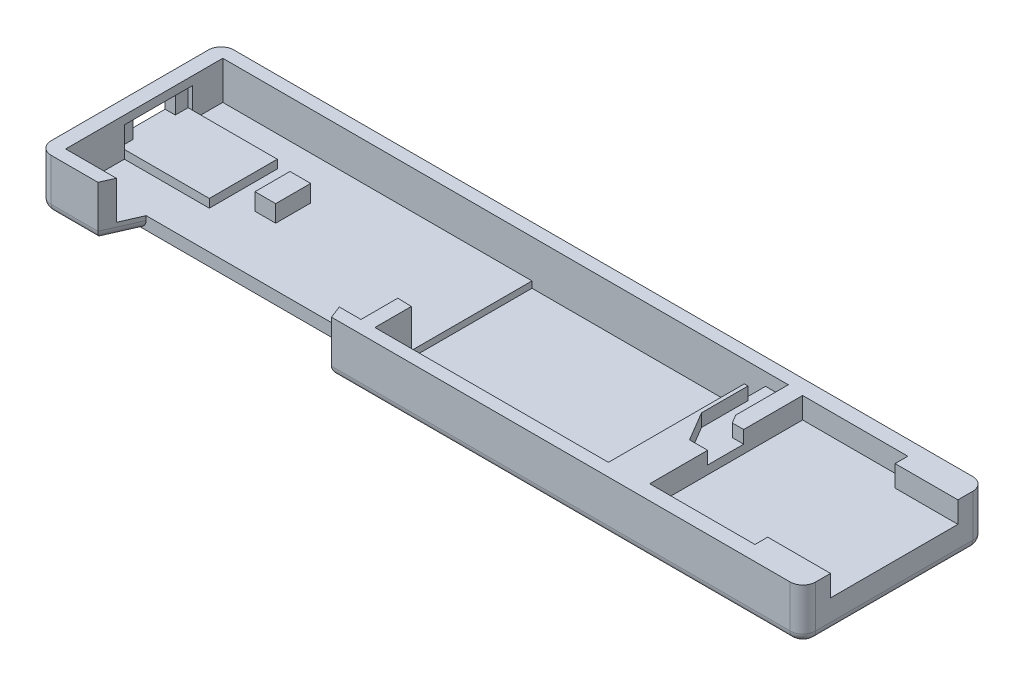
from build123d import *

# Parameters (mm, degrees)
SKETCH_3_W           = 180
SKETCH_3_H           = 43
EXTRUDE_1_DEPTH      = 12
CUT_EXTRUDE_1_DEPTH  = 52
CUT_EXTRUDE_2_DEPTH  = 5
CUT_EXTRUDE_3_DEPTH  = 5
SKETCH_8_W           = 55
SKETCH_8_H           = 37
CUT_EXTRUDE_4_DEPTH  = 10.5
CUT_EXTRUDE_5_DEPTH  = 3
SKETCH_10_W          = 62.128790526
SKETCH_10_H          = 8.683746703
CUT_EXTRUDE_6_DEPTH  = 8
CUT_EXTRUDE_8_DEPTH  = 9
FILLET_2_R           = 2
FILLET_3_R           = 3
SKETCH_12_W          = 20
SKETCH_12_H          = 16
EXTRUDE_2_DEPTH      = 2
SKETCH_13_W          = 16
SKETCH_13_H          = 5
CUT_EXTRUDE_9_DEPTH  = 1
SKETCH_14_W          = 10
SKETCH_14_H          = 4.5
CUT_EXTRUDE_10_DEPTH = 11
EXTRUDE_3_DEPTH      = 2
EXTRUDE_3_DEPTH_BACK = 3
SKETCH_15_W          = 4.878003414
SKETCH_15_H          = 8.248491994


with BuildPart() as part:
    # 草图3 → 凸台-拉伸1 (new body)
    with BuildSketch(Plane(origin=(0, 0, 0), x_dir=(1, 0, 0), z_dir=(0, 1, 0))):
        with Locations((50.068597249, 7.753123643)):
            Rectangle(SKETCH_3_W, SKETCH_3_H)
    extrude(amount=EXTRUDE_1_DEPTH)

    # 草图4 → 切除-拉伸1 (cut)
    with BuildSketch(Plane(origin=(0, 0, 0), x_dir=(1, 0, 0), z_dir=(0, 1, 0))):
        Polygon((-22.469613434, -5.858946979), (26.002261286, -5.858946979), (29.068597249, -13.746876357), (-25.931402751, -13.746876357), align=None)
    extrude(amount=CUT_EXTRUDE_1_DEPTH, mode=Mode.SUBTRACT)

    # 草图5 → 切除-拉伸2 (cut)
    with BuildSketch(Plane(origin=(0, 12, 0), x_dir=(1, 0, 0), z_dir=(0, 1, 0))):
        Polygon((140.068597249, 7.753123643), (140.068597249, 22.753123643), (125.276479966, 22.753123643), (125.276479966, -7.246876357), (140.068597249, -7.246876357), align=None)
    extrude(amount=-CUT_EXTRUDE_2_DEPTH, mode=Mode.SUBTRACT)

    # 草图7 → 切除-拉伸3 (cut)
    with BuildSketch(Plane(origin=(0, 12, 0), x_dir=(1, 0, 0), z_dir=(0, 1, 0))):
        Polygon((125.276479966, 7.753123643), (125.276479966, 25.753123643), (100.500825538, 25.753123643), (100.500825538, -10.246876357), (125.276479966, -10.246876357), align=None)
    extrude(amount=-CUT_EXTRUDE_3_DEPTH, mode=Mode.SUBTRACT)

    # 草图8 → 切除-拉伸4 (cut)
    with BuildSketch(Plane(origin=(0, 12, 0), x_dir=(1, 0, 0), z_dir=(0, 1, 0))):
        with Locations((63.776287419, 7.753123643)):
            Rectangle(SKETCH_8_W, SKETCH_8_H)
    extrude(amount=-CUT_EXTRUDE_4_DEPTH, mode=Mode.SUBTRACT)

    # 草图9 → 切除-拉伸5 (cut)
    with BuildSketch(Plane(origin=(0, 12, 0), x_dir=(1, 0, 0), z_dir=(0, 1, 0))):
        Polygon((91.276287419, 26.253123643), (96.635770173, 26.253123643), (96.635770173, 22.130591531), (96.635770173, 13.862098754), (97.813575381, 11.877191358), (100.500825538, 11.877191358), (100.500825538, 3.393971617), (96.236747254, 3.393971617), (92.132656028, 10.310430274), (92.132656028, 21.255120764), (91.276287419, 21.255120764), align=None)
    extrude(amount=-CUT_EXTRUDE_5_DEPTH, mode=Mode.SUBTRACT)

    # 草图10 → 切除-拉伸6 (cut)
    with BuildSketch(Plane(origin=(0, 12, 0), x_dir=(1, 0, 0), z_dir=(0, 1, 0))):
        with Locations((1.934159822, -6.405003006)):
            Rectangle(SKETCH_10_W, SKETCH_10_H)
    extrude(amount=-CUT_EXTRUDE_6_DEPTH, mode=Mode.SUBTRACT)

    # 草图11 → 切除-拉伸8 (cut)
    with BuildSketch(Plane(origin=(0, 12, 0), x_dir=(1, 0, 0), z_dir=(0, 1, 0))):
        Polygon((32.998555085, -10.746876357), (-36.5396752, -10.746876357), (-36.5396752, 26.253123643), (36.276287419, 26.253123643), (36.276287419, -2.167243749), (32.998555085, -2.063129654), align=None)
    extrude(amount=-CUT_EXTRUDE_8_DEPTH, mode=Mode.SUBTRACT)

    # 圆角2
    fillet_2_edges = [part.edges().sort_by_distance(p)[0] for p in [
        (84.568597249, 0, 13.746876357),
        (-24.200508092, 0, 9.802911668),
        (27.535429268, 0, 9.802911668),
        (50.068597249, 0, -29.253123643),
        (140.068597249, 0, -7.753123643),
        (-32.931402751, 0, 13.746876357),
        (-39.931402751, 0, -7.753123643),
    ]]
    fillet(fillet_2_edges, radius=FILLET_2_R)

    # 圆角3
    # the kernel refuses this fillet: 3 mm, written as the material it takes off along each edge
    with BuildSketch(Plane(origin=(-36.931402751, 0, 10.746876357), x_dir=(0, 0, 1), z_dir=(1, 0, 0))) as fillet_3_piece_1:
        with BuildLine():
            CenterArc((1, -2), 2, 0, 90)
            Line((3, -2), (3, 0))
            Line((3, 0), (1, 0))
        make_face()
    revolve(axis=Axis((-36.931402751, 0, 10.746876357), (0, -1, 0)), revolution_arc=90, mode=Mode.SUBTRACT)
    with BuildSketch(Plane(origin=(-36.931402751, 0, -26.253123643), x_dir=(-1, 0, 0), z_dir=(0, 0, 1))) as fillet_3_piece_2:
        with BuildLine():
            CenterArc((1, -2), 2, 0, 90)
            Line((3, -2), (3, 0))
            Line((3, 0), (1, 0))
        make_face()
    revolve(axis=Axis((-36.931402751, 0, -26.253123643), (0, -1, 0)), revolution_arc=90, mode=Mode.SUBTRACT)
    with BuildSketch(Plane(origin=(137.068597249, 0, 10.746876357), x_dir=(1, 0, 0), z_dir=(0, 0, -1))) as fillet_3_piece_3:
        with BuildLine():
            CenterArc((1, -2), 2, 0, 90)
            Line((3, -2), (3, 0))
            Line((3, 0), (1, 0))
        make_face()
    revolve(axis=Axis((137.068597249, 0, 10.746876357), (0, -1, 0)), revolution_arc=90, mode=Mode.SUBTRACT)
    with BuildSketch(Plane(origin=(137.068597249, 0, -26.253123643), x_dir=(0, 0, -1), z_dir=(-1, 0, 0))) as fillet_3_piece_4:
        with BuildLine():
            CenterArc((1, -2), 2, 0, 90)
            Line((3, -2), (3, 0))
            Line((3, 0), (1, 0))
        make_face()
    revolve(axis=Axis((137.068597249, 0, -26.253123643), (0, -1, 0)), revolution_arc=90, mode=Mode.SUBTRACT)
    with BuildSketch(Plane(origin=(-39.931402751, 0, -29.253123643), x_dir=(1, 0, 0), z_dir=(0, 1, 0))) as fillet_3_piece_5:
        with BuildLine():
            CenterArc((FILLET_3_R, -FILLET_3_R), FILLET_3_R, 90, 90)
            Line((0, -FILLET_3_R), (0, 0))
            Line((0, 0), (FILLET_3_R, 0))
        make_face()
    extrude(amount=19.5, mode=Mode.SUBTRACT)
    with BuildSketch(Plane(origin=(140.068597249, 0, -29.253123643), x_dir=(-1, 0, 0), z_dir=(0, 1, 0)), Plane(origin=(140.068597249, 0, 13.746876357), x_dir=(0, 0, -1), z_dir=(0, 1, 0)), Plane(origin=(-39.931402751, 0, 13.746876357), x_dir=(1, 0, 0), z_dir=(0, 1, 0))) as fillet_3_piece_6:
        with BuildLine():
            CenterArc((FILLET_3_R, FILLET_3_R), FILLET_3_R, 180, 90)
            Line((0, FILLET_3_R), (0, 0))
            Line((0, 0), (FILLET_3_R, 0))
        make_face()
    extrude(amount=19.5, mode=Mode.SUBTRACT)

    # 草图12 → 凸台-拉伸2 (add)
    with BuildSketch(Plane(origin=(0, 3, 0), x_dir=(1, 0, 0), z_dir=(0, 1, 0))):
        with Locations((-26.5396752, 11.082072108)):
            Rectangle(SKETCH_12_W, SKETCH_12_H)
    extrude(amount=EXTRUDE_2_DEPTH)

    # 草图13 → 切除-拉伸9 (cut)
    with BuildSketch(Plane(origin=(-36.5396752, 0, 0), x_dir=(0, 0, -1), z_dir=(1, 0, 0))):
        with Locations((11.082072108, 7.5)):
            Rectangle(SKETCH_13_W, SKETCH_13_H)
    extrude(amount=-CUT_EXTRUDE_9_DEPTH, mode=Mode.SUBTRACT)

    # 草图14 → 切除-拉伸10 (cut)
    with BuildSketch(Plane(origin=(-37.5396752, 0, 0), x_dir=(0, 0, -1), z_dir=(1, 0, 0))):
        with Locations((11.082072108, 7.25)):
            Rectangle(SKETCH_14_W, SKETCH_14_H)
    extrude(amount=-CUT_EXTRUDE_10_DEPTH, mode=Mode.SUBTRACT)

    # 草图15 → 凸台-拉伸3 (add, two sides: drawn at the far end of the back side and taken through both)
    with BuildSketch(Plane(origin=(0, 5, 0), x_dir=(1, 0, 0), z_dir=(0, 1, 0)).offset(-EXTRUDE_3_DEPTH_BACK)):
        with Locations((-8.100673493, 11.957826111)):
            Rectangle(SKETCH_15_W, SKETCH_15_H)
    extrude(amount=EXTRUDE_3_DEPTH + EXTRUDE_3_DEPTH_BACK)


solid = part.part
